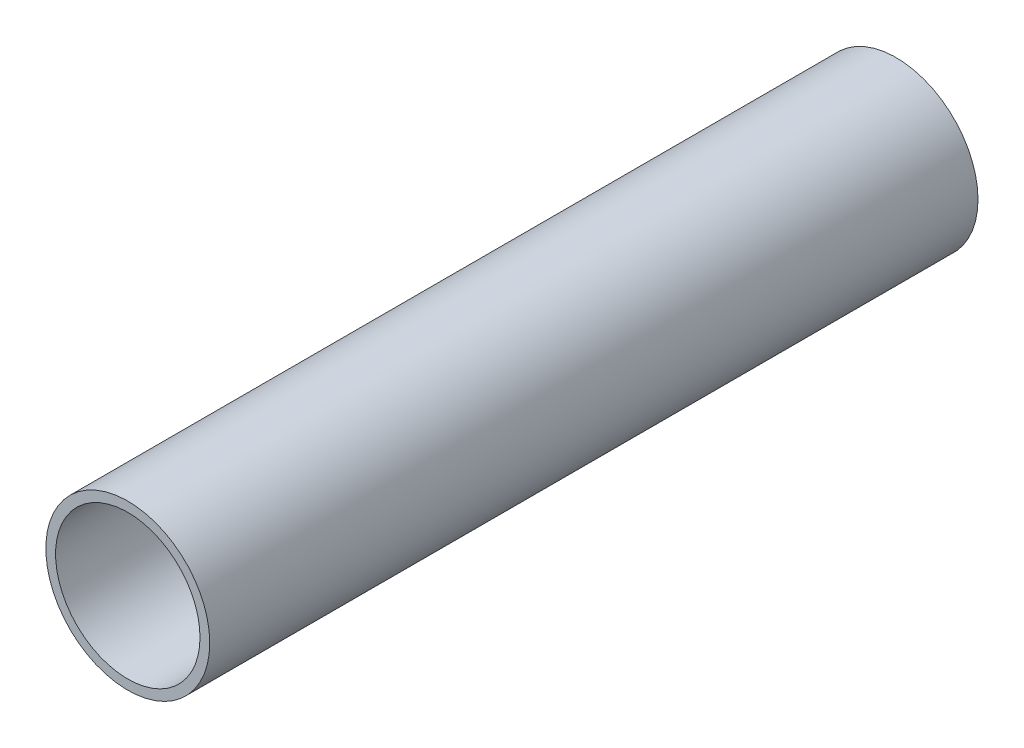
from build123d import *

# Parameters (mm, degrees)
PIPESKETCH_R    = 16
PIPESKETCH_R_2  = 14.1
EXTRUSION_DEPTH = 150


with BuildPart() as part:
    # PipeSketch → Extrusion (new body)
    with BuildSketch(Plane.XY):
        Circle(PIPESKETCH_R)
        Circle(PIPESKETCH_R_2, mode=Mode.SUBTRACT)
    extrude(amount=EXTRUSION_DEPTH)


solid = part.part
